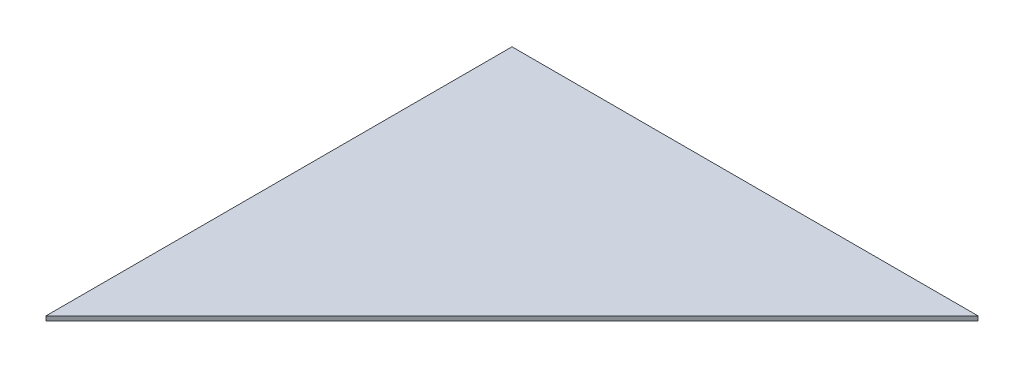
from build123d import *

# Parameters (mm, degrees)
SKETCH1_W           = 1219.2
SKETCH1_H           = 1219.2
BOSS_EXTRUDE1_DEPTH = 5.55625
CUT_EXTRUDE1_DEPTH  = 863.122492407


with BuildPart() as part:
    # Sketch1 → Boss-Extrude1 (new body)
    with BuildSketch(Plane(origin=(0, 0, 0), x_dir=(1, 0, 0), z_dir=(0, 1, 0))):
        Rectangle(SKETCH1_W, SKETCH1_H)
    extrude(amount=BOSS_EXTRUDE1_DEPTH)

    # Sketch2 → Cut-Extrude1 (cut, through all)
    with BuildSketch(Plane.XZ):
        Polygon((-609.6, -52.824120495), (-52.824120495, -609.6), (609.6, -609.6), (609.6, 609.6), (-609.6, 609.6), align=None)
    extrude(amount=-CUT_EXTRUDE1_DEPTH, mode=Mode.SUBTRACT)


solid = part.part
